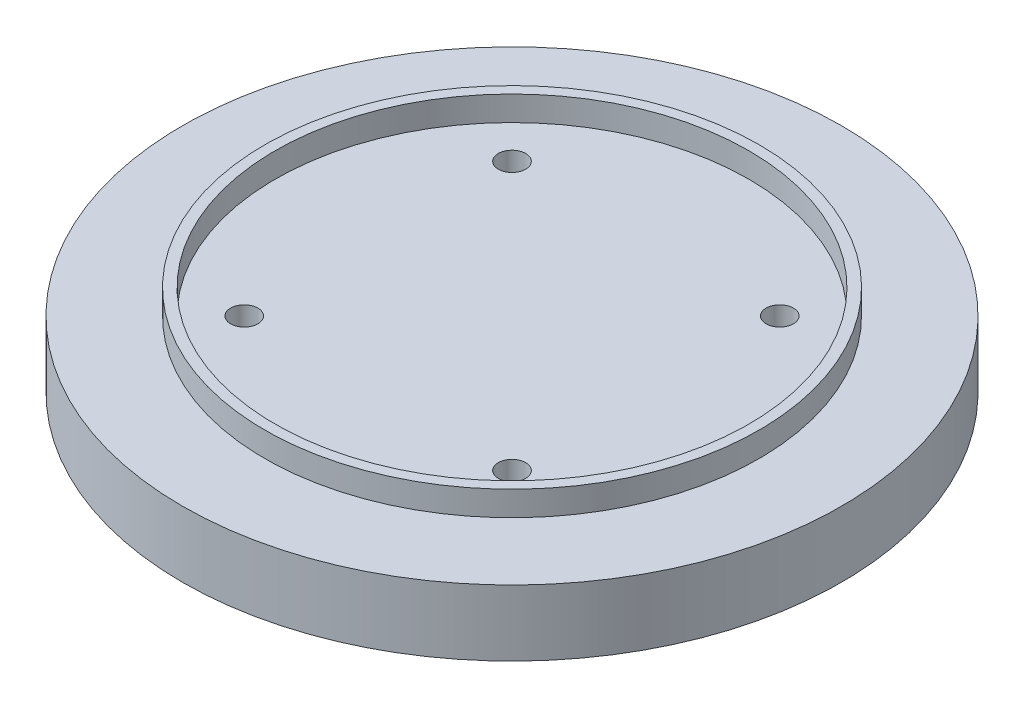
from build123d import *

# Parameters (mm, degrees)
SKETCH1_R                   = 101.6
BOSS_EXTRUDE1_DEPTH         = 10.16
F_3_8_24_TAPPED_HOLE2_D     = 8.4328
F_3_8_24_TAPPED_HOLE2_DEPTH = 13.462
F_3_8_24_TAPPED_HOLE2_TIP   = 2.533468714
F_3_8_24_TAPPED_HOLE1_D     = 8.4328
F_3_8_24_TAPPED_HOLE1_DEPTH = 14.224
F_3_8_24_TAPPED_HOLE1_TIP   = 2.533468714
SKETCH2_R                   = 76.2
SKETCH2_R_2                 = 73.025
BOSS_EXTRUDE2_DEPTH         = 7.62


with BuildPart() as part:
    # Sketch1 → Boss-Extrude1 (new, symmetric)
    with BuildSketch(Plane(origin=(0, 0, 0), x_dir=(1, 0, 0), z_dir=(0, 1, 0))):
        Circle(SKETCH1_R)
    extrude(amount=BOSS_EXTRUDE1_DEPTH, both=True)

    # 3/8-24 Tapped Hole2
    with Locations(Plane(origin=(0, 10.16, 0), x_dir=(1, 0, 0), z_dir=(0, 1, 0))):
        with Locations((-41.275, 41.275), (41.275, 41.275), (41.275, -41.275), (-41.275, -41.275)):
            Hole(F_3_8_24_TAPPED_HOLE2_D / 2, depth=F_3_8_24_TAPPED_HOLE2_DEPTH)
            with Locations((0, 0, -(F_3_8_24_TAPPED_HOLE2_DEPTH + F_3_8_24_TAPPED_HOLE2_TIP / 2))):  # 118° drill point
                Cone(0, F_3_8_24_TAPPED_HOLE2_D / 2, F_3_8_24_TAPPED_HOLE2_TIP, mode=Mode.SUBTRACT)

    # 3/8-24 Tapped Hole1
    with Locations(Plane(origin=(0, -10.16, 0), x_dir=(-1, 0, 0), z_dir=(0, -1, 0))):
        with Locations((50.8, -50.8), (-50.8, -50.8), (-50.8, 50.8), (50.8, 50.8)):
            Hole(F_3_8_24_TAPPED_HOLE1_D / 2, depth=F_3_8_24_TAPPED_HOLE1_DEPTH)
            with Locations((0, 0, -(F_3_8_24_TAPPED_HOLE1_DEPTH + F_3_8_24_TAPPED_HOLE1_TIP / 2))):  # 118° drill point
                Cone(0, F_3_8_24_TAPPED_HOLE1_D / 2, F_3_8_24_TAPPED_HOLE1_TIP, mode=Mode.SUBTRACT)

    # Sketch2 → Boss-Extrude2 (add)
    with BuildSketch(Plane(origin=(0, 10.16, 0), x_dir=(1, 0, 0), z_dir=(0, 1, 0))):
        Circle(SKETCH2_R)
        Circle(SKETCH2_R_2, mode=Mode.SUBTRACT)
    extrude(amount=BOSS_EXTRUDE2_DEPTH)


solid = part.part
